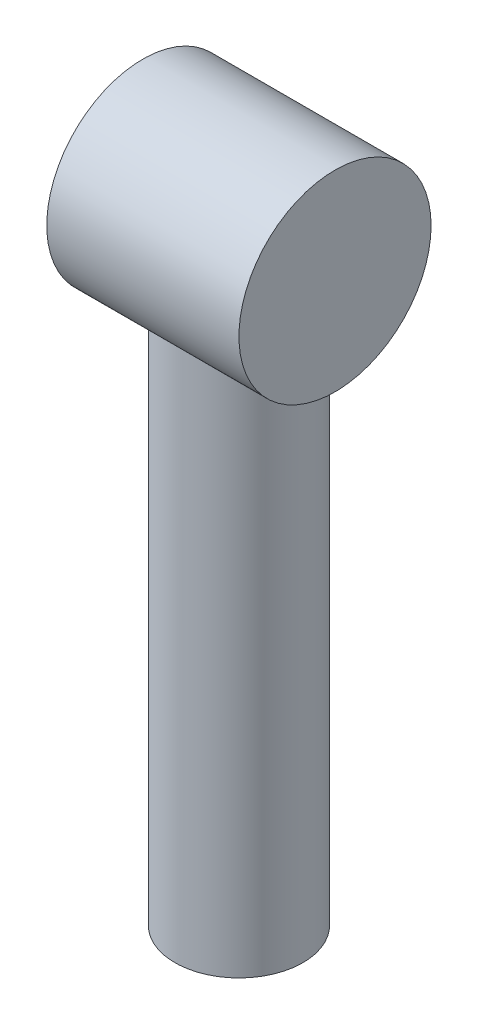
from build123d import *

# Parameters (mm, degrees)
SKETCH1_R                 = 20
BOSS_EXTRUDE1_DEPTH       = 25
BOSS_EXTRUDE2_START       = 100
SKETCH2_R                 = 20
BOSS_EXTRUDE2_DEPTH       = 100
BOSS_EXTRUDE4_START       = -100
SKETCH6_R                 = 20
BOSS_EXTRUDE4_DEPTH       = 100
SKETCH7_R                 = 25
CUT_EXTRUDE2_DEPTH        = 40
SKETCH8_R                 = 25
SKETCH8_R_2               = 22.5
BOSS_EXTRUDE7_DEPTH       = 40
SKETCH9_R                 = 25
BOSS_EXTRUDE8_DEPTH       = 2
BOSS_EXTRUDE10_DEPTH      = 38
CUT_EXTRUDE3_DEPTH        = 25
SKETCH12_R                = 25
CUT_EXTRUDE4_DEPTH        = 75
BOSS_EXTRUDE11_START      = 50
SKETCH14_R                = 20
BOSS_EXTRUDE11_DEPTH      = 50
BOSS_EXTRUDE12_DEPTH      = 10
BOSS_EXTRUDE12_DEPTH_BACK = 50
SKETCH13_R                = 30


with BuildPart() as part:
    # Sketch1 → Boss-Extrude1 (new body)
    with BuildSketch(Plane(origin=(0, 0, 0), x_dir=(1, 0, 0), z_dir=(0, 1, 0))):
        Circle(SKETCH1_R)
        Polygon((14.43375673, 0), (7.216878365, 12.5), (-7.216878365, 12.5), (-14.43375673, 0), (-7.216878365, -12.5), (7.216878365, -12.5), align=None, mode=Mode.SUBTRACT)
    extrude(amount=BOSS_EXTRUDE1_DEPTH)

    # Sketch2 → Boss-Extrude2 (add)
    with BuildSketch(Plane.XZ.offset(BOSS_EXTRUDE2_START)):
        Circle(SKETCH2_R)
    extrude(amount=-BOSS_EXTRUDE2_DEPTH)

    # Sketch6 → Boss-Extrude4 (add)
    with BuildSketch(Plane(origin=(0, 25, 0), x_dir=(1, 0, 0), z_dir=(0, 1, 0)).offset(BOSS_EXTRUDE4_START)):
        Circle(SKETCH6_R)
    extrude(amount=BOSS_EXTRUDE4_DEPTH)

    # Sketch7 → Cut-Extrude2 (cut)
    with BuildSketch(Plane(origin=(20, 0, 0), x_dir=(0, 0, -1), z_dir=(1, 0, 0))):
        with Locations((0, 39.286563349)):
            Circle(SKETCH7_R)
    extrude(amount=-CUT_EXTRUDE2_DEPTH, mode=Mode.SUBTRACT)

    # Sketch8 → Boss-Extrude7 (add)
    with BuildSketch(Plane(origin=(20, 0, 0), x_dir=(0, 0, -1), z_dir=(1, 0, 0))):
        with Locations((0, 39.252781264)):
            Circle(SKETCH8_R)
        with Locations((0, 39.252781264)):
            Circle(SKETCH8_R_2, mode=Mode.SUBTRACT)
    extrude(amount=-BOSS_EXTRUDE7_DEPTH)

    # Sketch9 → Boss-Extrude8 (add)
    with BuildSketch(Plane(origin=(20, 0, 0), x_dir=(0, 0, -1), z_dir=(1, 0, 0))):
        with Locations((0, 39.252781264)):
            Circle(SKETCH9_R)
    extrude(amount=-BOSS_EXTRUDE8_DEPTH)

    # Sketch10 → Boss-Extrude10 (add)
    with BuildSketch(Plane.ZY.offset(-18)):
        with BuildLine():
            Line((-15.081099266, 22.555163323), (15.081099266, 22.555163323))
            ThreePointArc((15.081099266, 22.555163323), (0, 16.752781264), (-15.081099266, 22.555163323))
        make_face()
    extrude(amount=BOSS_EXTRUDE10_DEPTH)

    # Sketch11 → Cut-Extrude3 (cut)
    with BuildSketch(Plane.XZ.offset(100)):
        Polygon((12.5, 7.216878365), (0, 14.43375673), (-12.5, 7.216878365), (-12.5, -7.216878365), (0, -14.43375673), (12.5, -7.216878365), align=None)
    extrude(amount=-CUT_EXTRUDE3_DEPTH, mode=Mode.SUBTRACT)

    # Sketch12 → Cut-Extrude4 (cut)
    with BuildSketch(Plane(origin=(20, 0, 0), x_dir=(0, 0, -1), z_dir=(1, 0, 0))):
        with Locations((0, 39.252781264)):
            Circle(SKETCH12_R)
    extrude(amount=-CUT_EXTRUDE4_DEPTH, mode=Mode.SUBTRACT)

    # Sketch14 → Boss-Extrude11 (add)
    with BuildSketch(Plane.XZ.offset(100).offset(BOSS_EXTRUDE11_START)):
        Circle(SKETCH14_R)
        Polygon((0, -14.43375673), (12.5, -7.216878365), (12.5, 7.216878365), (0, 14.43375673), (-12.5, 7.216878365), (-12.5, -7.216878365), align=None, mode=Mode.SUBTRACT)
    extrude(amount=-BOSS_EXTRUDE11_DEPTH)

    # Sketch13 → Boss-Extrude12 (add, two sides: drawn at the far end of the back side and taken through both)
    with BuildSketch(Plane(origin=(20, 0, 0), x_dir=(0, 0, -1), z_dir=(1, 0, 0)).offset(-BOSS_EXTRUDE12_DEPTH_BACK)):
        with Locations((0, 39.33472939)):
            Circle(SKETCH13_R)
    extrude(amount=BOSS_EXTRUDE12_DEPTH + BOSS_EXTRUDE12_DEPTH_BACK)


solid = part.part
